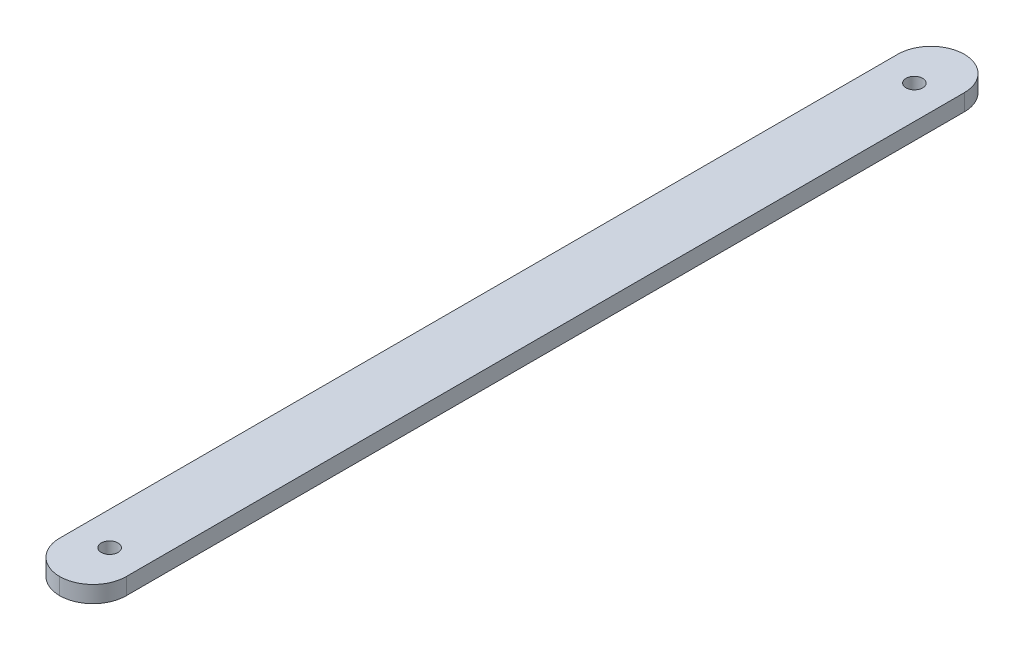
from build123d import *

# Parameters (mm, degrees)
SKETCH_1_W          = 20
SKETCH_1_H          = 5
EXTRUDE_1_DEPTH     = 271.75
SKETCH_2_R          = 2.5
CUT_EXTRUDE_1_DEPTH = 125.875
FILLET_1_R          = 10


with BuildPart() as part:
    # 草图1 → 凸台-拉伸1 (new body)
    with BuildSketch(Plane.XY):
        with Locations((7.706454687, 2.403044524)):
            Rectangle(SKETCH_1_W, SKETCH_1_H)
    extrude(amount=EXTRUDE_1_DEPTH)

    # 草图2 → 切除-拉伸1 (cut, symmetric)
    with BuildSketch(Plane(origin=(0, 0, 0), x_dir=(1, 0, 0), z_dir=(0, 1, 0))):
        with Locations((7.706454687, -15)):
            Circle(SKETCH_2_R)
        with Locations((7.706454687, -256.75)):
            Circle(SKETCH_2_R)
    extrude(amount=CUT_EXTRUDE_1_DEPTH, both=True, mode=Mode.SUBTRACT)

    # 圆角1
    fillet_1_edges = [part.edges().sort_by_distance(p)[0] for p in [
        (-2.293545313, 2.403044524, 0),
        (17.706454687, 2.403044524, 0),
        (-2.293545313, 2.403044524, 271.75),
        (17.706454687, 2.403044524, 271.75),
    ]]
    fillet(fillet_1_edges, radius=FILLET_1_R - 0.0001)  # a hair under: the kernel refuses the full size


solid = part.part
